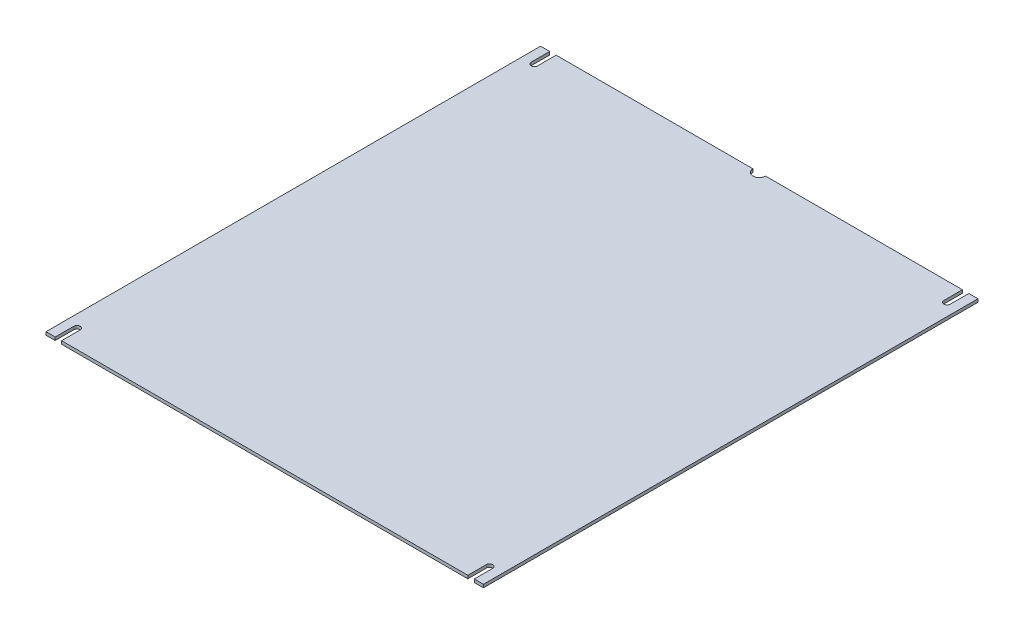
from build123d import *

# Parameters (mm, degrees)
SKETCH1_W          = 449.326
SKETCH1_H          = 508
BASE_FLANGE1_DEPTH = 3.175
CUT_EXTRUDE1_DEPTH = 679.209359196


# Sheet-metal steps are written as plain solids
with BuildPart() as part:
    # Sketch1 → Base-Flange1 (new body)
    with BuildSketch(Plane(origin=(0, 0, 0), x_dir=(1, 0, 0), z_dir=(0, 1, 0))):
        with Locations((224.663, 254)):
            Rectangle(SKETCH1_W, SKETCH1_H)
    extrude(amount=-BASE_FLANGE1_DEPTH)

    # Sketch6 → Cut-Extrude1 (cut, through all)
    with BuildSketch(Plane(origin=(0, 0, 0), x_dir=(1, 0, 0), z_dir=(0, 1, 0))):
        with BuildLine():
            Line((9.398, 19.05), (9.398, 0))
            Line((9.398, 0), (16.002, 0))
            Line((16.002, 0), (16.002, 19.05))
            ThreePointArc((16.002, 19.05), (12.7, 22.352), (9.398, 19.05))
        make_face()
        with BuildLine():
            Line((433.324, 19.05), (433.324, 0))
            Line((433.324, 0), (439.928, 0))
            Line((439.928, 0), (439.928, 19.05))
            ThreePointArc((439.928, 19.05), (436.626, 22.352), (433.324, 19.05))
        make_face()
        with BuildLine():
            Line((9.398, 488.95), (9.398, 508))
            Line((9.398, 508), (16.002, 508))
            Line((16.002, 508), (16.002, 488.95))
            ThreePointArc((16.002, 488.95), (12.7, 485.648), (9.398, 488.95))
        make_face()
        with BuildLine():
            Line((433.324, 488.95), (433.324, 508))
            Line((433.324, 508), (439.928, 508))
            Line((439.928, 508), (439.928, 488.95))
            ThreePointArc((439.928, 488.95), (436.626, 485.648), (433.324, 488.95))
        make_face()
        with BuildLine():
            Line((218.186, 508), (231.14, 508))
            ThreePointArc((231.14, 508), (224.663, 501.523), (218.186, 508))
        make_face()
    extrude(amount=-CUT_EXTRUDE1_DEPTH, mode=Mode.SUBTRACT)


solid = part.part
